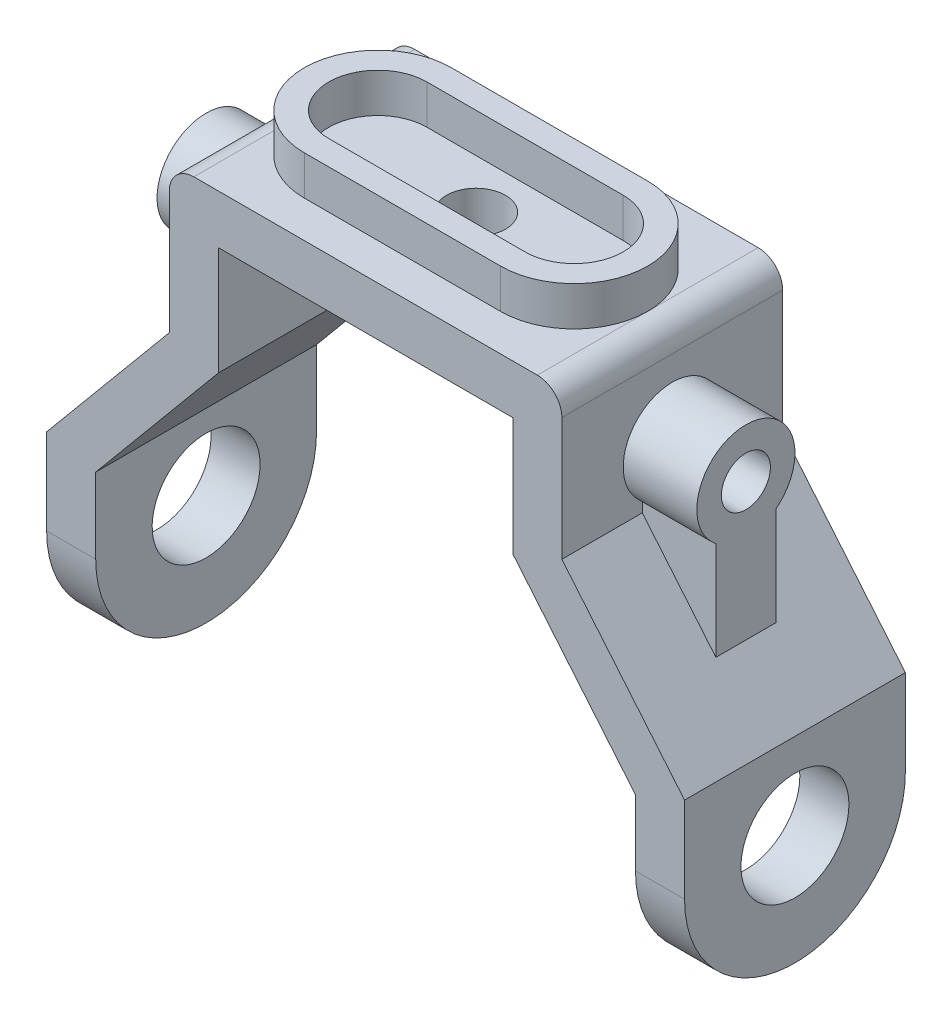
from build123d import *

# Parameters (mm, degrees)
SKETCH3_W               = 130
SKETCH3_H               = 45
BOSS_EXTRUDE1_DEPTH     = 100
CUT_EXTRUDE1_DEPTH      = 122.372360939
CUT_EXTRUDE1_DEPTH_BACK = 122.372360939
BOSS_EXTRUDE2_DEPTH     = 8
CUT_EXTRUDE2_DEPTH      = 122.372360939
CUT_EXTRUDE2_DEPTH_BACK = 122.372360939
CUT_EXTRUDE3_DEPTH      = 122.372360939
CUT_EXTRUDE3_DEPTH_BACK = 122.372360939
CUT_EXTRUDE4_DEPTH      = 122.372360939
CUT_EXTRUDE4_DEPTH_BACK = 122.372360939
FILLET3_R               = 5
SKETCH16_R              = 10
SKETCH16_R_2            = 5
BOSS_EXTRUDE3_DEPTH     = 15
SKETCH19_R              = 6
CUT_EXTRUDE5_DEPTH      = 122.372360939
CUT_EXTRUDE6_DEPTH      = 147.735305908
CUT_EXTRUDE6_DEPTH_BACK = 147.735305908
SKETCH23_R              = 5
CUT_EXTRUDE7_DEPTH      = 15
CUT_EXTRUDE8_DEPTH      = 15
CUT_EXTRUDE9_DEPTH      = 166.548331311
CUT_EXTRUDE9_DEPTH_BACK = 166.548331311
SKETCH28_R              = 11


with BuildPart() as part:
    # Sketch3 → Boss-Extrude1 (new body)
    with BuildSketch(Plane(origin=(0, 0, 0), x_dir=(1, 0, 0), z_dir=(0, 1, 0))):
        Rectangle(SKETCH3_W, SKETCH3_H)
    extrude(amount=-BOSS_EXTRUDE1_DEPTH)

    # Sketch5 → Cut-Extrude1 (cut, two sides: drawn at the far end of the back side and taken through both)
    with BuildSketch(Plane.XY.offset(-CUT_EXTRUDE1_DEPTH_BACK)):
        Polygon((-65, 0), (-40, 0), (-40, -30), (-65, -60), align=None)
        Polygon((65, 0), (40, 0), (40, -30), (65, -60), align=None)
    extrude(amount=CUT_EXTRUDE1_DEPTH + CUT_EXTRUDE1_DEPTH_BACK, mode=Mode.SUBTRACT)

    # Sketch7 → Boss-Extrude2 (add)
    with BuildSketch(Plane(origin=(0, 0, 0), x_dir=(1, 0, 0), z_dir=(0, 1, 0))):
        with BuildLine():
            Line((-20, 15), (20, 15))
            ThreePointArc((20, 15), (35, 0), (20, -15))
            Line((20, -15), (-20, -15))
            ThreePointArc((-20, -15), (-35, 0), (-20, 15))
        make_face()
        with BuildLine():
            Line((-20, 10), (20, 10))
            ThreePointArc((20, 10), (30, 0), (20, -10))
            Line((20, -10), (-20, -10))
            ThreePointArc((-20, -10), (-30, 0), (-20, 10))
        make_face(mode=Mode.SUBTRACT)
    extrude(amount=BOSS_EXTRUDE2_DEPTH)

    # Sketch9 → Cut-Extrude2 (cut, two sides: drawn at the far end of the back side and taken through both)
    with BuildSketch(Plane.XY.offset(-CUT_EXTRUDE2_DEPTH_BACK)):
        Polygon((-30, -32.113231403), (-55, -62.113231403), (-55, -100), (55, -100), (55, -64.057510222), (30, -34.057510222), (30, -10), (-30, -10), align=None)
    extrude(amount=CUT_EXTRUDE2_DEPTH + CUT_EXTRUDE2_DEPTH_BACK, mode=Mode.SUBTRACT)

    # Sketch11 → Cut-Extrude3 (cut, two sides: drawn at the far end of the back side and taken through both)
    with BuildSketch(Plane(origin=(0, 0, 0), x_dir=(0, 0, -1), z_dir=(1, 0, 0)).offset(-CUT_EXTRUDE3_DEPTH_BACK)):
        with BuildLine():
            Line((-22.5, -100), (0, -100))
            ThreePointArc((0, -100), (-15.909902577, -93.409902577), (-22.5, -77.5))
            Line((-22.5, -77.5), (-22.5, -100))
        make_face()
    extrude(amount=CUT_EXTRUDE3_DEPTH + CUT_EXTRUDE3_DEPTH_BACK, mode=Mode.SUBTRACT)

    # Sketch12 → Cut-Extrude4 (cut, two sides: drawn at the far end of the back side and taken through both)
    with BuildSketch(Plane(origin=(0, 0, 0), x_dir=(0, 0, -1), z_dir=(1, 0, 0)).offset(-CUT_EXTRUDE4_DEPTH_BACK)):
        with BuildLine():
            Line((22.5, -100), (22.5, -77.5))
            ThreePointArc((22.5, -77.5), (15.909902577, -93.409902577), (0, -100))
            Line((0, -100), (22.5, -100))
        make_face()
    extrude(amount=CUT_EXTRUDE4_DEPTH + CUT_EXTRUDE4_DEPTH_BACK, mode=Mode.SUBTRACT)

    # Fillet3
    fillet3_edges = [part.edges().sort_by_distance(p)[0] for p in [
        (-40, 0, 0),
        (40, 0, 0),
    ]]
    fillet(fillet3_edges, radius=FILLET3_R - 0.0001)  # a hair under: the kernel refuses the full size

    # Sketch16 → Boss-Extrude3 (add)
    # profile 1 of 4: a face of its own
    with BuildSketch(Plane(origin=(40, 0, 0), x_dir=(0, 0, -1), z_dir=(1, 0, 0))):
        with Locations((0, -20)):
            Circle(SKETCH16_R)
        with Locations((0, -20)):
            Circle(SKETCH16_R_2, mode=Mode.SUBTRACT)
    # profile 2 of 4: a face of its own
    with BuildSketch(Plane(origin=(40, 0, 0), x_dir=(0, 0, -1), z_dir=(1, 0, 0))):
        with BuildLine():
            Line((1.3e-08, -30), (6.111197294, -30))
            Line((6.111197294, -30), (6.111197294, -27.915381711))
            ThreePointArc((6.111197294, -27.915381711), (3.228481297, -29.464507833), (1.3e-08, -30))
        make_face()
    # profile 3 of 4: a face of its own
    with BuildSketch(Plane(origin=(40, 0, 0), x_dir=(0, 0, -1), z_dir=(1, 0, 0))):
        with BuildLine():
            Line((-6.111197294, -27.915381711), (-6.111197294, -30))
            Line((-6.111197294, -30), (1.3e-08, -30))
            ThreePointArc((1.3e-08, -30), (-3.228481284, -29.464507837), (-6.111197294, -27.915381711))
        make_face()
    # profile 4 of 4: a face of its own
    with BuildSketch(Plane(origin=(40, 0, 0), x_dir=(0, 0, -1), z_dir=(1, 0, 0))):
        Polygon((-6.111197294, -30), (-6.111197294, -48.004109964), (6.111197294, -48.004109964), (6.111197294, -30), (1.3e-08, -30), align=None)
    boss_extrude3 = extrude(amount=BOSS_EXTRUDE3_DEPTH)

    # Mirror4: Boss-Extrude3 across plane
    add(boss_extrude3.mirror(Plane(origin=(0, 0, 0), x_dir=(0, 0, 1), z_dir=(1, 0, 0))))

    # Sketch19 → Cut-Extrude5 (cut, through all)
    with BuildSketch(Plane(origin=(0, 0, 0), x_dir=(1, 0, 0), z_dir=(0, 1, 0))):
        with Locations(Location((0, 0, 0), (0, 0, 270))):
            Circle(SKETCH19_R)
    extrude(amount=-CUT_EXTRUDE5_DEPTH, mode=Mode.SUBTRACT)

    # Sketch23 → Cut-Extrude6 (cut, two sides: drawn at the far end of the back side and taken through both)
    with BuildSketch(Plane(origin=(40, 0, 0), x_dir=(0, 0, -1), z_dir=(1, 0, 0)).offset(-CUT_EXTRUDE6_DEPTH_BACK)):
        with Locations((0, -20)):
            Circle(SKETCH23_R)
    extrude(amount=CUT_EXTRUDE6_DEPTH + CUT_EXTRUDE6_DEPTH_BACK, mode=Mode.SUBTRACT)

    # Sketch26 → Cut-Extrude7 (cut)
    with BuildSketch(Plane.XY.offset(6.111197294)):
        Polygon((-40, -44.113231403), (-40, -48.004109964), (-43.2423988, -48.004109964), align=None)
    extrude(amount=-CUT_EXTRUDE7_DEPTH, mode=Mode.SUBTRACT)

    # Sketch27 → Cut-Extrude8 (cut)
    with BuildSketch(Plane.XY.offset(6.111197294)):
        Polygon((40, -46.057510222), (40, -48.004109964), (41.622166452, -48.004109964), align=None)
    extrude(amount=-CUT_EXTRUDE8_DEPTH, mode=Mode.SUBTRACT)

    # Sketch28 → Cut-Extrude9 (cut, two sides: drawn at the far end of the back side and taken through both)
    with BuildSketch(Plane(origin=(65, 0, 0), x_dir=(0, 0, -1), z_dir=(1, 0, 0)).offset(-CUT_EXTRUDE9_DEPTH_BACK)):
        with Locations((0, -77.5)):
            Circle(SKETCH28_R)
    extrude(amount=CUT_EXTRUDE9_DEPTH + CUT_EXTRUDE9_DEPTH_BACK, mode=Mode.SUBTRACT)


solid = part.part
